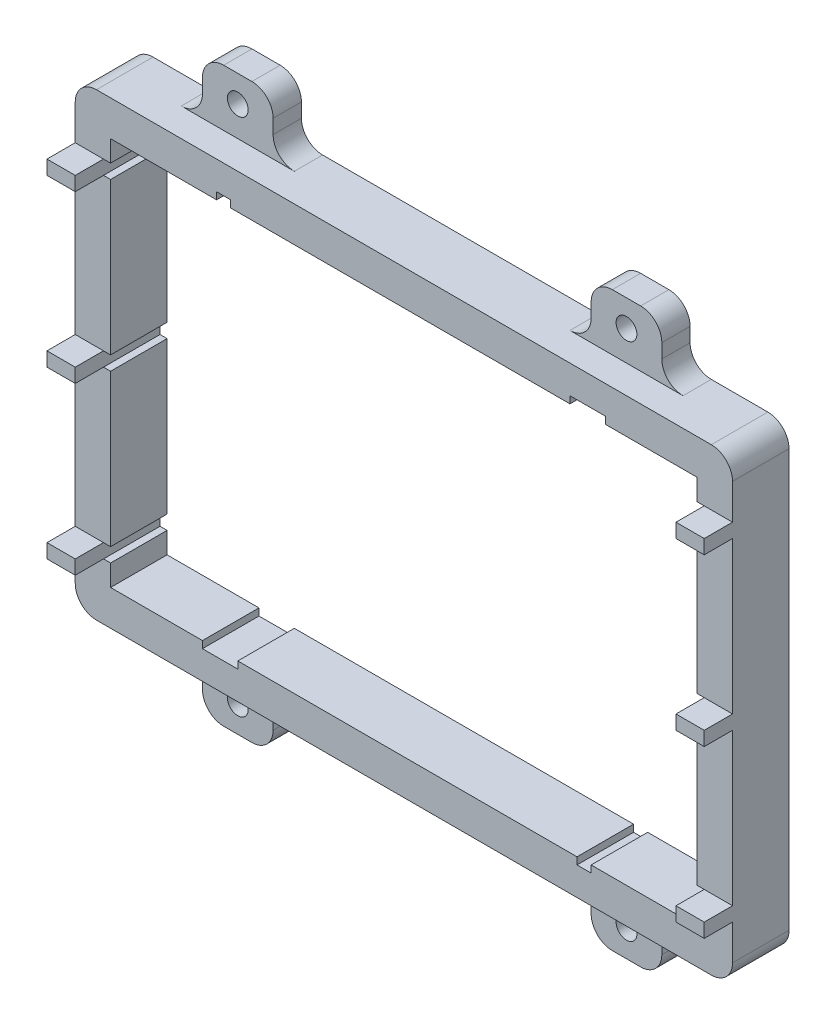
from build123d import *

# Parameters (mm, degrees)
SKETCH1_W               = 93
SKETCH1_H               = 65
SKETCH1_W_2             = 83
SKETCH1_H_2             = 55
BOSS_EXTRUDE1_DEPTH     = 8
FILLET1_R               = 3
SKETCH2_W               = 10
SKETCH2_H               = 4
BOSS_EXTRUDE6_DEPTH     = 8
FILLET3_R               = 3
SKETCH9_R               = 1.47
CUT_EXTRUDE1_DEPTH      = 62.794012655
MIRROR4_COPY_1_SKETCH_R = 1.47
MIRROR4_COPY_1_DEPTH    = 62.794012655
MIRROR4_COPY_2_SKETCH_R = 1.47
MIRROR4_COPY_2_DEPTH    = 62.794012655
FILLET4_R               = 3
SKETCH10_W              = 2
SKETCH10_H              = 1
SKETCH10_W_2            = 5
CUT_EXTRUDE2_DEPTH      = 63.181186865
SKETCH11_W              = 2
SKETCH11_H              = 1
SKETCH11_W_2            = 5
CUT_EXTRUDE3_DEPTH      = 63.181186865
SKETCH12_W              = 1
SKETCH12_H              = 2
CUT_EXTRUDE4_DEPTH      = 63.181186865
SKETCH14_W              = 4
SKETCH14_H              = 2
BOSS_EXTRUDE14_DEPTH    = 4


with BuildPart() as part:
    # Sketch1 → Boss-Extrude1 (new body)
    with BuildSketch(Plane.XY):
        Rectangle(SKETCH1_W, SKETCH1_H)
        Rectangle(SKETCH1_W_2, SKETCH1_H_2, mode=Mode.SUBTRACT)
    extrude(amount=BOSS_EXTRUDE1_DEPTH)

    # Fillet1
    fillet1_edges = [part.edges().sort_by_distance(p)[0] for p in [
        (-46.5, -32.5, 4),
        (-46.5, 32.5, 4),
        (46.5, -32.5, 4),
        (46.5, 32.5, 4),
    ]]
    fillet(fillet1_edges, radius=FILLET1_R)

    # Sketch2 → Boss-Extrude6 (add)
    with BuildSketch(Plane(origin=(0, 32.5, 0), x_dir=(1, 0, 0), z_dir=(0, 1, 0))):
        with Locations((-27.5, -2)):
            Rectangle(SKETCH2_W, SKETCH2_H)
        with Locations((27.5, -2)):
            Rectangle(SKETCH2_W, SKETCH2_H)
    boss_extrude6 = extrude(amount=BOSS_EXTRUDE6_DEPTH)

    # Mirror2: Boss-Extrude6 across plane
    add(boss_extrude6.mirror(Plane.ZX))

    # Fillet3
    fillet3_edges = [part.edges().sort_by_distance(p)[0] for p in [
        (32.5, -32.5, 2),
        (22.5, -32.5, 2),
        (-22.5, -32.5, 2),
        (-32.5, -32.5, 2),
        (-32.5, 32.5, 2),
        (-22.5, 32.5, 2),
        (22.5, 32.5, 2),
        (32.5, 32.5, 2),
    ]]
    fillet(fillet3_edges, radius=FILLET3_R)

    # Sketch9 → Cut-Extrude1 (cut, through all)
    with BuildSketch(Plane.XY.offset(4)):
        with Locations((27.5, -36.742693553)):
            Circle(SKETCH9_R)
    cut_extrude1 = extrude(amount=-CUT_EXTRUDE1_DEPTH, mode=Mode.SUBTRACT)

    # Mirror3: Cut-Extrude1 across plane
    add(cut_extrude1.mirror(Plane(origin=(0, 0, 0), x_dir=(0, 0, 1), z_dir=(1, 0, 0))), mode=Mode.SUBTRACT)

    # Mirror4 copy 1 sketch → Mirror4 copy 1 (cut, through all)
    with BuildSketch(Plane(origin=(0, 0, 4), x_dir=(-1, 0, 0), z_dir=(0, 0, 1))):
        with Locations((27.5, -36.742693553)):
            Circle(MIRROR4_COPY_1_SKETCH_R)
    extrude(amount=-MIRROR4_COPY_1_DEPTH, mode=Mode.SUBTRACT)

    # Mirror4 copy 2 sketch → Mirror4 copy 2 (cut, through all)
    with BuildSketch(Plane.XY.offset(4)):
        with Locations((27.5, 36.742693553)):
            Circle(MIRROR4_COPY_2_SKETCH_R)
    extrude(amount=-MIRROR4_COPY_2_DEPTH, mode=Mode.SUBTRACT)

    # Fillet4
    fillet4_edges = [part.edges().sort_by_distance(p)[0] for p in [
        (-22.5, 40.5, 2),
        (-32.5, 40.5, 2),
        (22.5, 40.5, 2),
        (32.5, 40.5, 2),
        (32.5, -40.5, 2),
        (22.5, -40.5, 2),
        (-22.5, -40.5, 2),
        (-32.5, -40.5, 2),
    ]]
    fillet(fillet4_edges, radius=FILLET4_R)

    # Sketch10 → Cut-Extrude2 (cut, through all)
    with BuildSketch(Plane(origin=(0, 0, 0), x_dir=(-1, 0, 0), z_dir=(0, 0, -1))):
        with Locations((-25.5, -28)):
            Rectangle(SKETCH10_W, SKETCH10_H)
        with Locations((26, -28)):
            Rectangle(SKETCH10_W_2, SKETCH10_H)
    extrude(amount=-CUT_EXTRUDE2_DEPTH, mode=Mode.SUBTRACT)

    # Sketch11 → Cut-Extrude3 (cut, through all)
    with BuildSketch(Plane(origin=(0, 0, 0), x_dir=(-1, 0, 0), z_dir=(0, 0, -1))):
        with Locations((25.5, 28)):
            Rectangle(SKETCH11_W, SKETCH11_H)
        with Locations((-26, 28)):
            Rectangle(SKETCH11_W_2, SKETCH11_H)
    extrude(amount=-CUT_EXTRUDE3_DEPTH, mode=Mode.SUBTRACT)

    # Sketch12 → Cut-Extrude4 (cut, through all)
    with BuildSketch(Plane(origin=(0, 0, 0), x_dir=(-1, 0, 0), z_dir=(0, 0, -1))):
        with Locations((-42, 0)):
            Rectangle(SKETCH12_W, SKETCH12_H)
        with Locations((-42, -23.5)):
            Rectangle(SKETCH12_W, SKETCH12_H)
        with Locations((-42, 23.5)):
            Rectangle(SKETCH12_W, SKETCH12_H)
    cut_extrude4 = extrude(amount=-CUT_EXTRUDE4_DEPTH, mode=Mode.SUBTRACT)

    # Mirror5: Cut-Extrude4 across plane
    add(cut_extrude4.mirror(Plane(origin=(0, 0, 0), x_dir=(0, 0, 1), z_dir=(1, 0, 0))), mode=Mode.SUBTRACT)

    # Sketch14 → Boss-Extrude14 (add)
    with BuildSketch(Plane.XY.offset(8)):
        with Locations((44.5, 23.5)):
            Rectangle(SKETCH14_W, SKETCH14_H)
        with Locations((44.5, 0)):
            Rectangle(SKETCH14_W, SKETCH14_H)
        with Locations((44.5, -23.5)):
            Rectangle(SKETCH14_W, SKETCH14_H)
    boss_extrude14 = extrude(amount=BOSS_EXTRUDE14_DEPTH)

    # Mirror6: Boss-Extrude14 across plane
    add(boss_extrude14.mirror(Plane(origin=(0, 0, 0), x_dir=(0, 0, 1), z_dir=(1, 0, 0))))


solid = part.part
